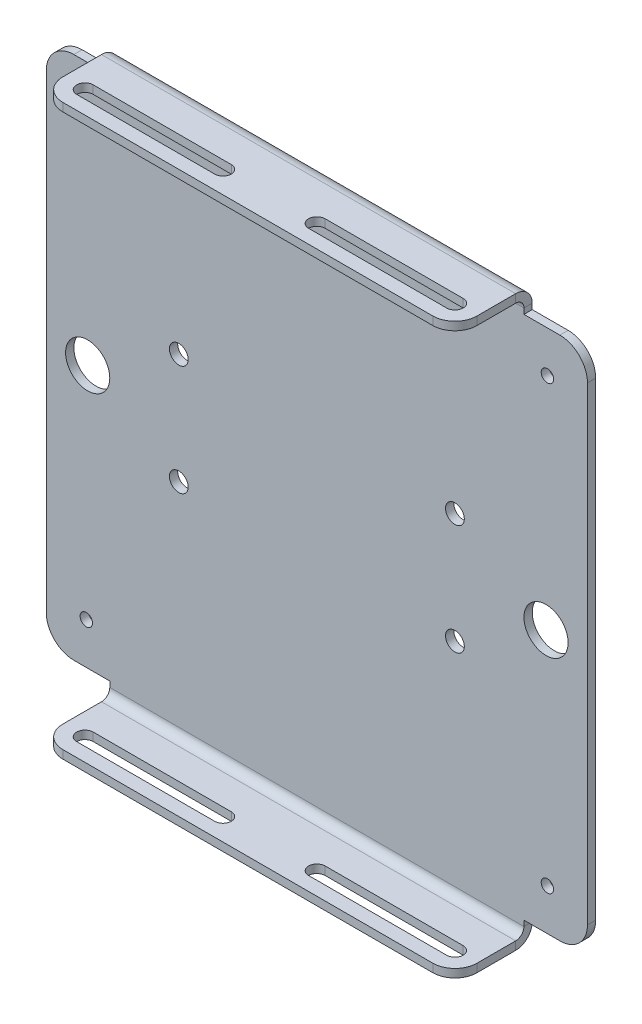
from build123d import *

# Parameters (mm, degrees)
CROQUIS1_W                       = 196
CROQUIS1_H                       = 190
SALIENTE_EXTRUIR1_DEPTH          = 3
CROQUIS3_R                       = 8
CORTAR_EXTRUIR1_DEPTH            = 50
REDONDEO1_R                      = 10
TALADRO_ROSCADO_M81_D            = 6.8
TALADRO_ROSCADO_M81_DEPTH        = 17
TALADRO_ROSCADO_M81_TIP          = 2.042926105
MATRIZL1_COUNT                   = 2
MATRIZL1_PITCH                   = 160
CROQUIS12_W                      = 150
CROQUIS12_H                      = 2
SALIENTE_EXTRUIR6_DEPTH          = 3
BRIDA_DE_ARISTA1_DEPTH           = 150
BRIDA_DE_ARISTA1_BEND_DEPTH      = 150
REDONDEO5_R                      = 8
TALADRO_DE_MARGEN_PARA_M51_D     = 5.5
TALADRO_DE_MARGEN_PARA_M51_DEPTH = 500
TALADRO_DE_MARGEN_PARA_M51_TIP   = 1.652366702
CORTAR_EXTRUIR2_DEPTH            = 230.834723225


# Sheet-metal steps are written as plain solids
with BuildPart() as part:
    # Croquis1 → Saliente-Extruir1 (new body)
    with BuildSketch(Plane.XY):
        Rectangle(CROQUIS1_W, CROQUIS1_H)
    extrude(amount=SALIENTE_EXTRUIR1_DEPTH)

    # Croquis3 → Cortar-Extruir1 (cut, symmetric)
    with BuildSketch(Plane.XY.offset(3)):
        with Locations((83, 0)):
            Circle(CROQUIS3_R)
        with Locations((-83, 0)):
            Circle(CROQUIS3_R)
    extrude(amount=CORTAR_EXTRUIR1_DEPTH, both=True, mode=Mode.SUBTRACT)

    # Redondeo1
    redondeo1_edges = [part.edges().sort_by_distance(p)[0] for p in [
        (-98, 95, 1.5),
        (98, 95, 1.5),
        (98, -95, 1.5),
        (-98, -95, 1.5),
    ]]
    fillet(redondeo1_edges, radius=REDONDEO1_R)

    # Taladro roscado M81
    with Locations(Plane(origin=(0, 0, 0), x_dir=(-1, 0, 0), z_dir=(0, 0, -1))):
        with Locations((-50, 20), (-50, -20), (50, 20), (50, -20)):
            Hole(TALADRO_ROSCADO_M81_D / 2, depth=TALADRO_ROSCADO_M81_DEPTH)
            with Locations((0, 0, -(TALADRO_ROSCADO_M81_DEPTH + TALADRO_ROSCADO_M81_TIP / 2))):  # 118° drill point
                Cone(0, TALADRO_ROSCADO_M81_D / 2, TALADRO_ROSCADO_M81_TIP, mode=Mode.SUBTRACT)

    # Croquis9 → Taladro de margen para M41 (revolve, cut)
    with BuildSketch(Plane(origin=(-83.5, -80, 0), x_dir=(0, 1, 0), z_dir=(1, 0, 0))):
        Polygon((0, 0), (0, 501.351936393), (2.25, 500), (2.25, 0), align=None)
    taladro_de_margen_para_m41 = revolve(axis=Axis((-83.5, -80, -6.35), (0, 0, 1)), mode=Mode.SUBTRACT)

    # MatrizL1: Taladro de margen para M41 ×2
    with Locations(*[(0, i * MATRIZL1_PITCH, 0) for i in range(1, MATRIZL1_COUNT)]):
        add(taladro_de_margen_para_m41, mode=Mode.SUBTRACT)

    # Simetría3: Taladro de margen para M41 across plane
    add(taladro_de_margen_para_m41.mirror(Plane(origin=(0, 0, 0), x_dir=(0, 0, 1), z_dir=(1, 0, 0))), mode=Mode.SUBTRACT)

    # Simetría3 copy 1 sketch → Simetría3 copy 1 (revolve, cut)
    with BuildSketch(Plane(origin=(83.5, 80, 0), x_dir=(0, 1, 0), z_dir=(-1, 0, 0))):
        Polygon((0, 0), (0, -501.351936393), (2.25, -500), (2.25, 0), align=None)
    revolve(axis=Axis((83.5, 80, -6.35), (0, 0, -1)), mode=Mode.SUBTRACT)

    # Croquis12 → Saliente-Extruir6 (add)
    with BuildSketch(Plane.XY.offset(3)):
        with Locations((0, 96)):
            Rectangle(CROQUIS12_W, CROQUIS12_H)
    saliente_extruir6 = extrude(amount=-SALIENTE_EXTRUIR6_DEPTH)

    # Simetría4: Saliente-Extruir6 across plane
    add(saliente_extruir6.mirror(Plane.ZX))

    # Brida de arista1 section (across the edge) → Brida de arista1 (add)
    with BuildSketch(Plane(origin=(-75, -100, 3), x_dir=(0, 1, 0), z_dir=(1, 0, 0))):
        with BuildLine():
            Line((-3, 3), (-3, 25))
            Line((-3, 25), (0, 25))
            Line((0, 25), (0, 3))
            ThreePointArc((0, 3), (0.878679656, 0.878679656), (3, 0))
            Line((3, 0), (3, -3))
            ThreePointArc((3, -3), (-1.242640687, -1.242640687), (-3, 3))
        make_face()
    extrude(amount=BRIDA_DE_ARISTA1_DEPTH)

    # Brida de arista1 section 2 (across the edge) → Brida de arista1 bend (add)
    with BuildSketch(Plane(origin=(75, 100, 3), x_dir=(0, -1, 0), z_dir=(-1, 0, 0))):
        with BuildLine():
            Line((-3, 3), (-3, 25))
            Line((-3, 25), (0, 25))
            Line((0, 25), (0, 3))
            ThreePointArc((0, 3), (0.878679656, 0.878679656), (3, 0))
            Line((3, 0), (3, -3))
            ThreePointArc((3, -3), (-1.242640687, -1.242640687), (-3, 3))
        make_face()
    extrude(amount=BRIDA_DE_ARISTA1_BEND_DEPTH)

    # Redondeo5
    redondeo5_edges = [part.edges().sort_by_distance(p)[0] for p in [
        (-75, -101.5, 28),
        (75, -101.5, 28),
        (75, 101.5, 28),
        (-75, 101.5, 28),
    ]]
    fillet(redondeo5_edges, radius=REDONDEO5_R)

    # Taladro de margen para M51
    with Locations(Plane(origin=(0, -103, 0), x_dir=(-1, 0, 0), z_dir=(0, -1, 0))):
        with Locations((67, -20), (-67, -20), (17, -20), (-17, -20)):
            Hole(TALADRO_DE_MARGEN_PARA_M51_D / 2, depth=TALADRO_DE_MARGEN_PARA_M51_DEPTH)
            with Locations((0, 0, -(TALADRO_DE_MARGEN_PARA_M51_DEPTH + TALADRO_DE_MARGEN_PARA_M51_TIP / 2))):  # 118° drill point
                Cone(0, TALADRO_DE_MARGEN_PARA_M51_D / 2, TALADRO_DE_MARGEN_PARA_M51_TIP, mode=Mode.SUBTRACT)

    # Croquis25 → Cortar-Extruir2 (cut, through all)
    with BuildSketch(Plane.XZ.offset(103)):
        with BuildLine():
            Line((67, 17), (17, 17))
            ThreePointArc((17, 17), (14, 20), (17, 23))
            Line((17, 23), (67, 23))
            ThreePointArc((67, 23), (70, 20), (67, 17))
        make_face()
        with BuildLine():
            Line((-17, 17), (-67, 17))
            ThreePointArc((-67, 17), (-70, 20), (-67, 23))
            Line((-67, 23), (-17, 23))
            ThreePointArc((-17, 23), (-14, 20), (-17, 17))
        make_face()
    extrude(amount=-CORTAR_EXTRUIR2_DEPTH, mode=Mode.SUBTRACT)


solid = part.part
